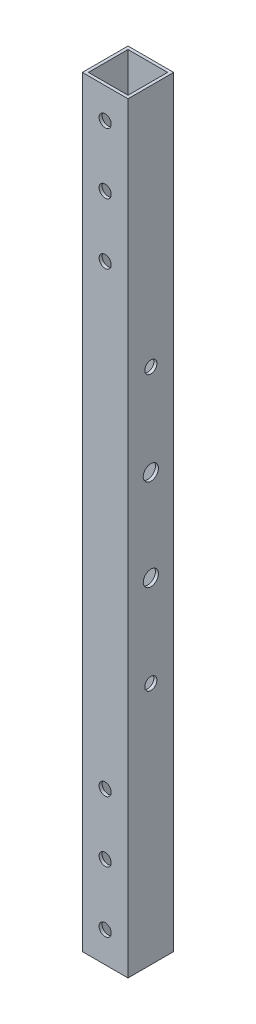
from build123d import *

# Parameters (mm, degrees)
SKETCH_1_W          = 15
SKETCH_1_H          = 15
SKETCH_1_W_2        = 13
SKETCH_1_H_2        = 13
EXTRUDE_1_DEPTH     = 250
SKETCH_3_R          = 2
CUT_EXTRUDE_2_DEPTH = 251.561868607
SKETCH_5_R          = 2.5
SKETCH_5_R_2        = 2
CUT_EXTRUDE_4_DEPTH = 251.561868607


with BuildPart() as part:
    # 草图1 → 凸台-拉伸1 (new body)
    with BuildSketch(Plane(origin=(0, 0, 0), x_dir=(1, 0, 0), z_dir=(0, 1, 0))):
        Rectangle(SKETCH_1_W, SKETCH_1_H)
        Rectangle(SKETCH_1_W_2, SKETCH_1_H_2, mode=Mode.SUBTRACT)
    extrude(amount=EXTRUDE_1_DEPTH)

    # 草图3 → 切除-拉伸2 (cut, through all)
    with BuildSketch(Plane.XY.offset(7.5)):
        with Locations((0, 240)):
            Circle(SKETCH_3_R)
        with Locations((0, 220)):
            Circle(SKETCH_3_R)
        with Locations((0, 30)):
            Circle(SKETCH_3_R)
        with Locations((0, 10)):
            Circle(SKETCH_3_R)
        with Locations((0, 200)):
            Circle(SKETCH_3_R)
        with Locations((0, 50)):
            Circle(SKETCH_3_R)
    extrude(amount=-CUT_EXTRUDE_2_DEPTH, mode=Mode.SUBTRACT)

    # 草图5 → 切除-拉伸4 (cut, through all)
    with BuildSketch(Plane(origin=(7.5, 0, 0), x_dir=(0, 0, -1), z_dir=(1, 0, 0))):
        with Locations((0, 140)):
            Circle(SKETCH_5_R)
        with Locations((0, 110)):
            Circle(SKETCH_5_R)
        with Locations((0, 170)):
            Circle(SKETCH_5_R_2)
        with Locations((0, 80)):
            Circle(SKETCH_5_R_2)
    extrude(amount=-CUT_EXTRUDE_4_DEPTH, mode=Mode.SUBTRACT)


solid = part.part
